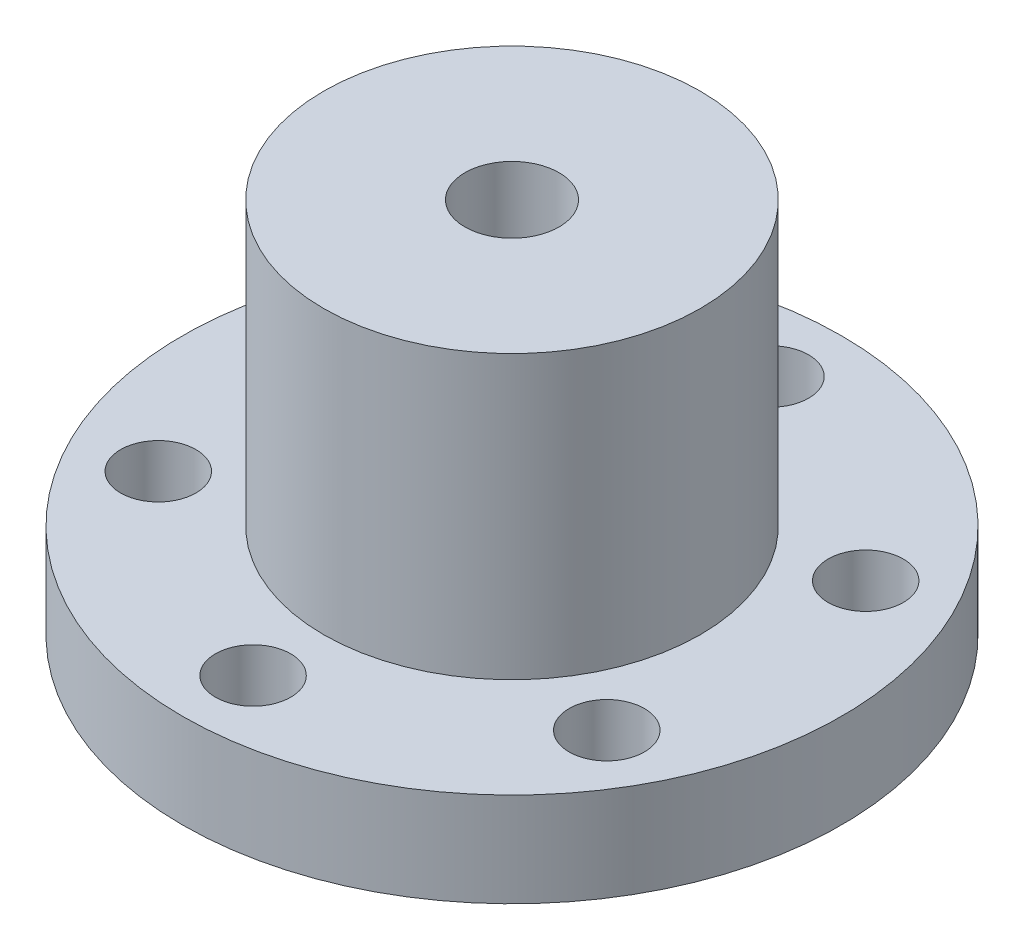
from build123d import *

# Parameters (mm, degrees)
SKETCH2_R           = 17.5
SKETCH2_R_2         = 2
BOSS_EXTRUDE1_DEPTH = 5
SKETCH3_R           = 10
BOSS_EXTRUDE2_DEPTH = 15
SKETCH4_R           = 2.5
CUT_EXTRUDE1_DEPTH  = 32.819805153


with BuildPart() as part:
    # Sketch2 → Boss-Extrude1 (new body)
    with BuildSketch(Plane(origin=(0, 0, 0), x_dir=(1, 0, 0), z_dir=(0, 1, 0))):
        Circle(SKETCH2_R)
        with Locations((0, 13.75)):
            Circle(SKETCH2_R_2, mode=Mode.SUBTRACT)
        with Locations((11.907849302, 6.875)):
            Circle(SKETCH2_R_2, mode=Mode.SUBTRACT)
        with Locations((11.907849302, -6.875)):
            Circle(SKETCH2_R_2, mode=Mode.SUBTRACT)
        with Locations((0, -13.75)):
            Circle(SKETCH2_R_2, mode=Mode.SUBTRACT)
        with Locations((-11.907849302, -6.875)):
            Circle(SKETCH2_R_2, mode=Mode.SUBTRACT)
        with Locations((-11.907849302, 6.875)):
            Circle(SKETCH2_R_2, mode=Mode.SUBTRACT)
    extrude(amount=BOSS_EXTRUDE1_DEPTH)

    # Sketch3 → Boss-Extrude2 (add)
    with BuildSketch(Plane(origin=(0, 5, 0), x_dir=(1, 0, 0), z_dir=(0, 1, 0))):
        Circle(SKETCH3_R)
    extrude(amount=BOSS_EXTRUDE2_DEPTH)

    # Sketch4 → Cut-Extrude1 (cut, through all)
    with BuildSketch(Plane(origin=(0, 20, 0), x_dir=(1, 0, 0), z_dir=(0, 1, 0))):
        Circle(SKETCH4_R)
    extrude(amount=-CUT_EXTRUDE1_DEPTH, mode=Mode.SUBTRACT)


solid = part.part
